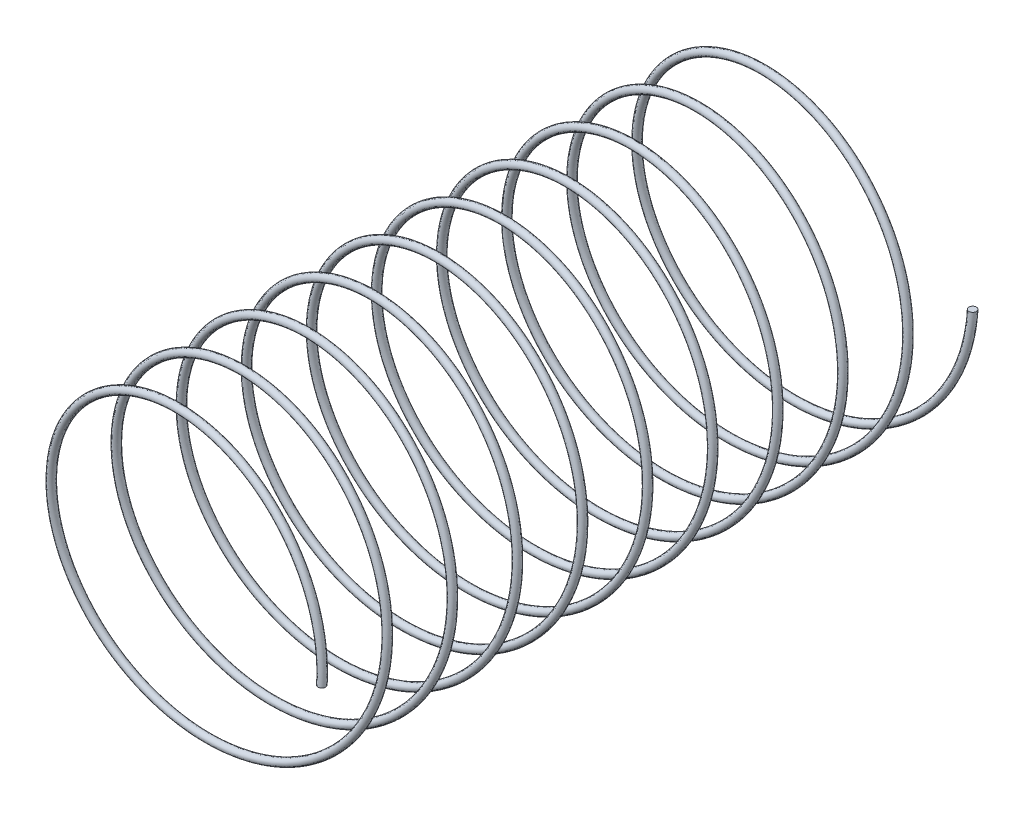
from build123d import *

# Parameters (mm, degrees)
SWEEP1_PITCH  = 2.1844
SWEEP1_HEIGHT = 21.844
SWEEP1_RADIUS = 5.08
SKETCH2_R     = 0.127


with BuildPart() as part:
    # Sweep1: sweep along a helix
    with BuildLine() as sweep1_path:
        Helix(SWEEP1_PITCH, SWEEP1_HEIGHT, SWEEP1_RADIUS, center=(0, 0, 0), direction=(0, 0, 1), lefthand=True)
    # Sketch2 → Sweep1 (sweep)
    with BuildSketch(Plane(origin=(0, 0, 0), x_dir=(1, 0, 0), z_dir=(0, 1, 0))):
        with Locations((5.08, 0)):
            Circle(SKETCH2_R)
    sweep(path=sweep1_path.line, is_frenet=True)


solid = part.part
